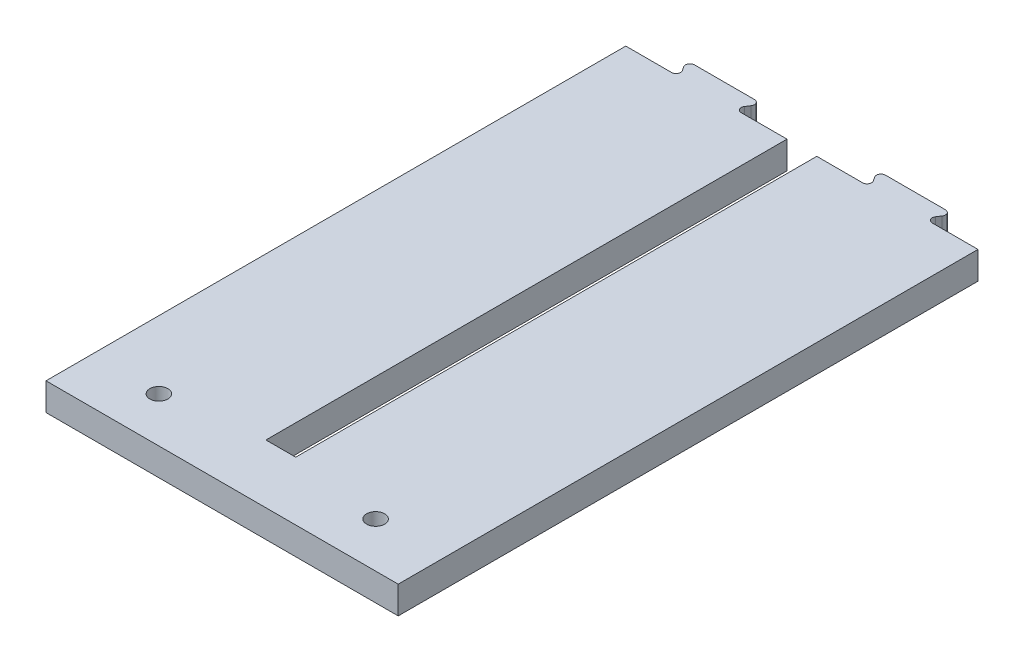
from build123d import *

# Parameters (mm, degrees)
SKETCH1_W           = 39
SKETCH1_H           = 72.5
BOSS_EXTRUDE1_DEPTH = 3.05
SKETCH4_W           = 3.3
SKETCH4_H           = 1
SKETCH4_H_2         = 61.8
CUT_EXTRUDE1_DEPTH  = 76.138555349
SKETCH7_R           = 1
CUT_EXTRUDE4_DEPTH  = 76.138555349
SKETCH8_W           = 39
SKETCH8_H           = 8.3
CUT_EXTRUDE5_DEPTH  = 76.138555349
BOSS_EXTRUDE3_DEPTH = 3.05
FILLET2_R           = 0.5


with BuildPart() as part:
    # Sketch1 → Boss-Extrude1 (new body)
    with BuildSketch(Plane(origin=(0, 0, 0), x_dir=(1, 0, 0), z_dir=(0, 1, 0))):
        with Locations((0, 36.25)):
            Rectangle(SKETCH1_W, SKETCH1_H)
    extrude(amount=BOSS_EXTRUDE1_DEPTH)

    # Sketch4 → Cut-Extrude1 (cut, through all)
    with BuildSketch(Plane(origin=(0, 3.05, 0), x_dir=(1, 0, 0), z_dir=(0, 1, 0))):
        with Locations((0, 70)):
            Rectangle(SKETCH4_W, SKETCH4_H)
        with Locations((0, 37.4)):
            Rectangle(SKETCH4_W, SKETCH4_H_2)
    extrude(amount=-CUT_EXTRUDE1_DEPTH, mode=Mode.SUBTRACT)

    # Sketch7 → Cut-Extrude4 (cut, through all)
    with BuildSketch(Plane(origin=(0, 3.05, 0), x_dir=(1, 0, 0), z_dir=(0, 1, 0))):
        with Locations((-12, 5)):
            Circle(SKETCH7_R)
        with Locations((12, 5)):
            Circle(SKETCH7_R)
    extrude(amount=-CUT_EXTRUDE4_DEPTH, mode=Mode.SUBTRACT)

    # Sketch8 → Cut-Extrude5 (cut, through all)
    with BuildSketch(Plane(origin=(0, 3.05, 0), x_dir=(1, 0, 0), z_dir=(0, 1, 0))):
        with Locations((0, 68.35)):
            Rectangle(SKETCH8_W, SKETCH8_H)
    extrude(amount=-CUT_EXTRUDE5_DEPTH, mode=Mode.SUBTRACT)

    # Sketch9 → Boss-Extrude3 (add)
    with BuildSketch(Plane(origin=(0, 3.05, 0), x_dir=(1, 0, 0), z_dir=(0, 1, 0))):
        Polygon((-14.825, 66.2), (-13.5, 64.2), (-7.65, 64.2), (-6.325, 66.2), align=None)
        Polygon((6.325, 66.2), (7.65, 64.2), (13.5, 64.2), (14.825, 66.2), align=None)
    extrude(amount=-BOSS_EXTRUDE3_DEPTH)

    # Fillet2
    fillet2_edges = [part.edges().sort_by_distance(p)[0] for p in [
        (13.5, 1.525, -64.2),
        (-7.65, 1.525, -64.2),
        (14.825, 1.525, -66.2),
        (7.65, 1.525, -64.2),
        (6.325, 1.525, -66.2),
        (-6.325, 1.525, -66.2),
        (-14.825, 1.525, -66.2),
        (-13.5, 1.525, -64.2),
    ]]
    fillet(fillet2_edges, radius=FILLET2_R)


solid = part.part
